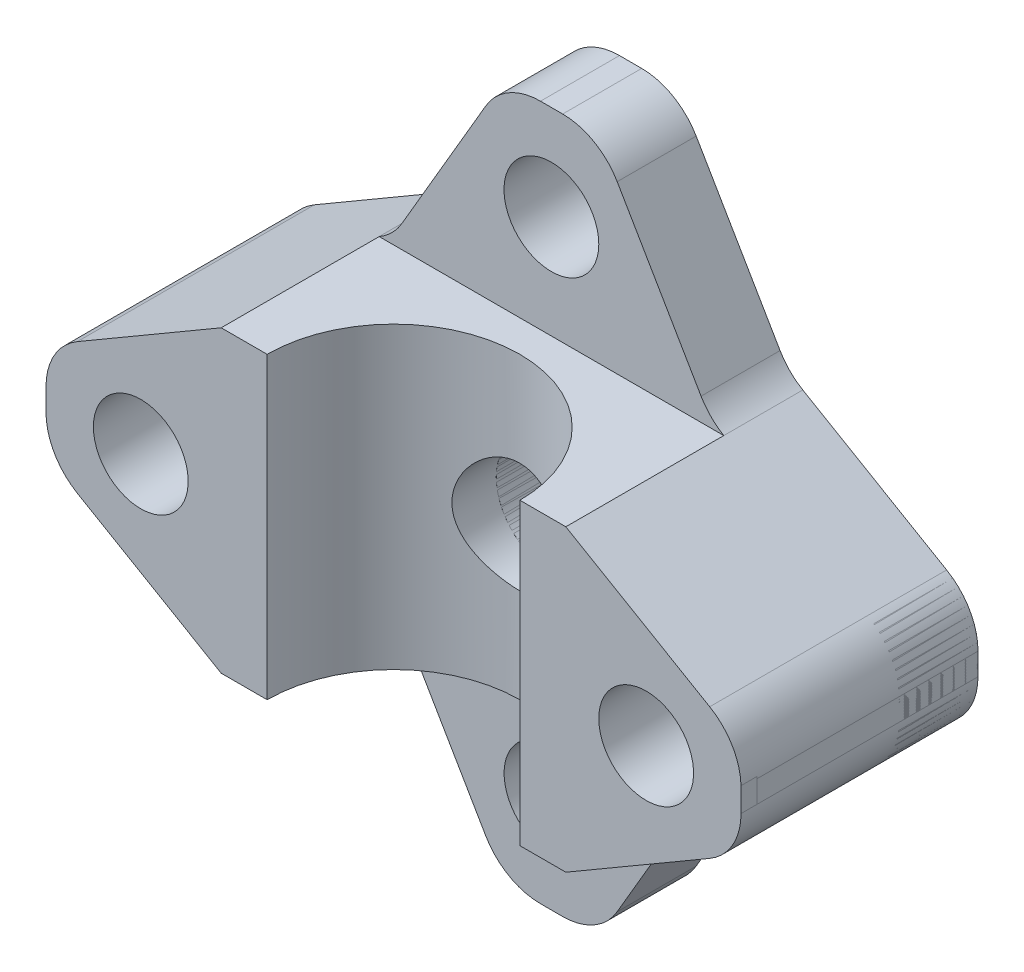
from build123d import *
from OCP.BRepAlgoAPI import BRepAlgoAPI_Cut
from OCP.TopTools import TopTools_ListOfShape

# Parameters (mm, degrees)
SKETCH1_R           = 1.5
BOSS_EXTRUDE1_DEPTH = 2.5
CUT_EXTRUDE1_DEPTH  = 2.5
SKETCH3_R           = 1.75
CUT_EXTRUDE2_DEPTH  = 2.5
FILLET1_R           = 2
SKETCH4_R           = 1.5
SKETCH4_R_2         = 1.75
BOSS_EXTRUDE2_DEPTH = 15
CUT_EXTRUDE3_DEPTH  = 10


with BuildPart() as part:
    # Sketch1 → Boss-Extrude1 (new body)
    with BuildSketch(Plane.XY):
        Polygon((1.501919425, 10.998080575), (-1.498048949, 11.001951051), (-10.998080575, 1.501919425), (-11.001951051, -1.498048949), (-1.501919425, -10.998080575), (1.498048949, -11.001951051), (10.998080575, -1.501919425), (11.001951051, 1.498048949), align=None)
        with Locations((-0.002801443, 8)):
            Circle(SKETCH1_R, mode=Mode.SUBTRACT)
        with Locations((7.997198557, 0.002801443)):
            Circle(SKETCH1_R, mode=Mode.SUBTRACT)
        with Locations((0, -7.997198557)):
            Circle(SKETCH1_R, mode=Mode.SUBTRACT)
        with Locations((-8, 0)):
            Circle(SKETCH1_R, mode=Mode.SUBTRACT)
    extrude(amount=BOSS_EXTRUDE1_DEPTH)

    # Sketch2 → Cut-Extrude1 (cut)
    with BuildSketch(Plane.XY.offset(2.5)):
        Polygon((-10.998080575, 1.501919425), (-5, 5), (-1.498048949, 11.001951051), align=None)
        Polygon((-1.501919425, -10.998080575), (-5, -5), (-11.001951051, -1.498048949), align=None)
        Polygon((1.501919425, 10.998080575), (5, 5), (11.001951051, 1.498048949), align=None)
        Polygon((10.998080575, -1.501919425), (5, -5), (1.498048949, -11.001951051), align=None)
    extrude(amount=-CUT_EXTRUDE1_DEPTH, mode=Mode.SUBTRACT)

    # Sketch3 → Cut-Extrude2 (cut)
    with BuildSketch(Plane.XY.offset(2.5)):
        Circle(SKETCH3_R)
    extrude(amount=-CUT_EXTRUDE2_DEPTH, mode=Mode.SUBTRACT)

    # Fillet1
    fillet1_edges = [part.edges().sort_by_distance(p)[0] for p in [
        (-10.998080575, 1.501919425, 1.25),
        (-5, 5, 1.25),
        (-1.498048949, 11.001951051, 1.25),
        (1.501919425, 10.998080575, 1.25),
        (5, 5, 1.25),
        (11.001951051, 1.498048949, 1.25),
        (10.998080575, -1.501919425, 1.25),
        (5, -5, 1.25),
        (1.498048949, -11.001951051, 1.25),
        (-1.501919425, -10.998080575, 1.25),
        (-5, -5, 1.25),
        (-11.001951051, -1.498048949, 1.25),
    ]]
    fillet(fillet1_edges, radius=FILLET1_R)


with BuildPart() as body_2:
    # Sketch4 → Boss-Extrude2 (new body)
    with BuildSketch(Plane.XY):
        with BuildLine():
            Line((5.454592231, 4.734759626), (-5.454645413, 4.734850796))
            Line((-5.454645413, 4.734850796), (-10.007132442, 2.079840374))
            ThreePointArc((-10.007132442, 2.079840374), (-10.733154021, 1.349508566), (-10.999560605, 0.354762663))
            Line((-10.999560605, 0.354762663), (-11.000466938, -0.347727289))
            ThreePointArc((-11.000466938, -0.347727289), (-10.735445402, -1.345222455), (-10.008385222, -2.07776359))
            Line((-10.008385222, -2.07776359), (-5.454592231, -4.734759626))
            Line((-5.454592231, -4.734759626), (5.454645413, -4.734850796))
            Line((5.454645413, -4.734850796), (10.007132442, -2.079840374))
            ThreePointArc((10.007132442, -2.079840374), (10.733154021, -1.349508566), (10.999560605, -0.354762663))
            Line((10.999560605, -0.354762663), (11.000466938, 0.347727289))
            ThreePointArc((11.000466938, 0.347727289), (10.735445402, 1.345222455), (10.008385222, 2.07776359))
            Line((10.008385222, 2.07776359), (5.454592231, 4.734759626))
        make_face()
        with Locations((-8, 0)):
            Circle(SKETCH4_R, mode=Mode.SUBTRACT)
        Circle(SKETCH4_R_2, mode=Mode.SUBTRACT)
        with Locations((7.997198557, 0.002801443)):
            Circle(SKETCH4_R, mode=Mode.SUBTRACT)
    extrude(amount=BOSS_EXTRUDE2_DEPTH)


with BuildPart() as cut_extrude3_tool:
    # Sketch5 → Cut-Extrude3 (new body)
    with BuildSketch(Plane(origin=(-3.9569e-05, -4.734805211, 0), x_dir=(0.9999999999650793, -8.357134608074512e-06, 0), z_dir=(-8.357134608074512e-06, -0.9999999999650793, 0))):
        with BuildLine():
            Line((-11.000464032, 7.5), (-4.000450231, 7.5))
            ThreePointArc((-4.000450231, 7.5), (-0.000450231, 3.5), (3.999549769, 7.5))
            Line((3.999549769, 7.5), (10.999563569, 7.5))
            Line((10.999563569, 7.5), (10.999563569, 7))
            Line((10.999563569, 7), (12.263859783, 7))
            Line((12.263859783, 7), (12.263859783, 16))
            Line((12.263859783, 16), (-11.000464032, 16))
            Line((-11.000464032, 16), (-11.000464032, 7.5))
        make_face()
    extrude(amount=-CUT_EXTRUDE3_DEPTH)


with BuildPart() as body_2_1:
    add(body_2.part)

    # Cut-Extrude3: cut by cut_extrude3_tool, with a tolerance
    cut_extrude3_stock = TopTools_ListOfShape()
    cut_extrude3_stock.Append(body_2_1.part.wrapped)
    cut_extrude3_tools = TopTools_ListOfShape()
    cut_extrude3_tools.Append(cut_extrude3_tool.part.wrapped)
    cut_extrude3_cut = BRepAlgoAPI_Cut()
    cut_extrude3_cut.SetArguments(cut_extrude3_stock)
    cut_extrude3_cut.SetTools(cut_extrude3_tools)
    cut_extrude3_cut.SetFuzzyValue(0.00001)
    cut_extrude3_cut.Build()
    add(Compound.cast(cut_extrude3_cut.Shape()).solids(), mode=Mode.REPLACE)


solid = Compound([part.part, body_2_1.part])
